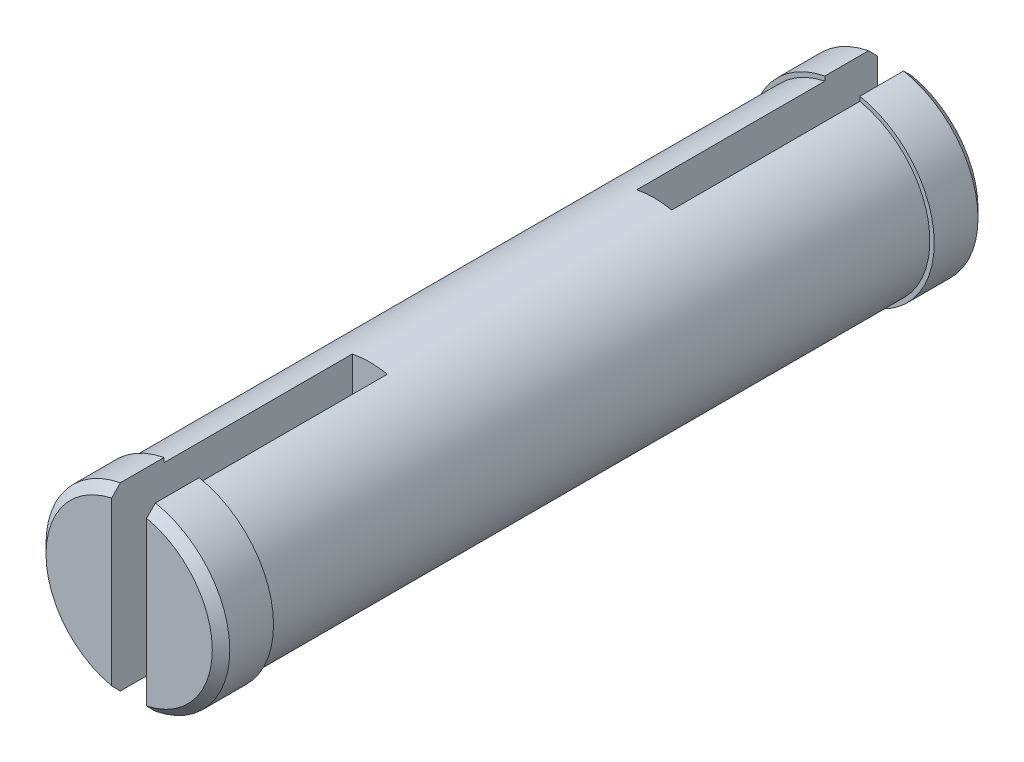
from build123d import *

# Parameters (mm, degrees)
SKETCH_1_R          = 2
EXTRUDE_1_DEPTH     = 8.75
SKETCH_2_R          = 2.1
EXTRUDE_2_DEPTH     = 1.2
CHAMFER_1_SIZE      = 0.2
SKETCH_3_W          = 0.8
SKETCH_3_H          = 4.5
CUT_EXTRUDE_1_DEPTH = 5.5


# Read off the part's stored shape, not the designer's step: 镜向1
with BuildPart() as part:
    # 草图1 → 凸台-拉伸1 (new body)
    with BuildSketch(Plane.XY):
        Circle(SKETCH_1_R)
    extrude(amount=EXTRUDE_1_DEPTH)

    # 草图2 → 凸台-拉伸2 (add)
    with BuildSketch(Plane.XY.offset(8.75)):
        Circle(SKETCH_2_R)
    extrude(amount=-EXTRUDE_2_DEPTH)

    # 倒角1
    chamfer_1_edges = [part.edges().sort_by_distance(p)[0] for p in [
        (-2.1, 0, 8.75),
    ]]
    chamfer(chamfer_1_edges, length=CHAMFER_1_SIZE)

    # 草图3 → 切除-拉伸1 (cut)
    with BuildSketch(Plane.XY.offset(8.75)):
        Rectangle(SKETCH_3_W, SKETCH_3_H)
    extrude(amount=-CUT_EXTRUDE_1_DEPTH, mode=Mode.SUBTRACT)

    # 镜向1: part across plane


with BuildPart() as part_1:
    add(part.part)
    add(part.part.mirror(Plane.XY))


solid = part_1.part
